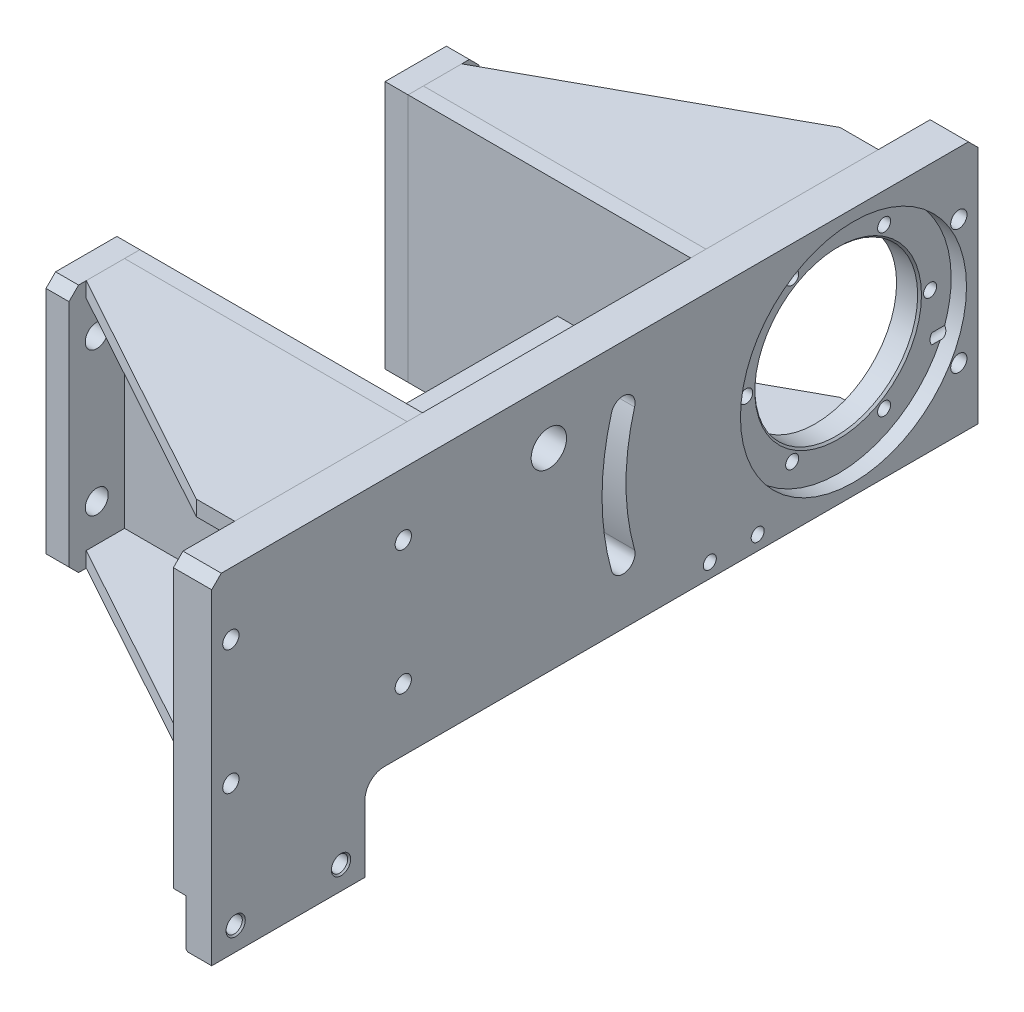
from build123d import *

# Parameters (mm, degrees)
EXTRUDE_1_DEPTH              = 65
EXTRUDE_1_DEPTH_BACK         = 65
SKETCH_2_W                   = 147.5
SKETCH_2_H                   = 8
EXTRUDE_1_2_DEPTH            = 65
EXTRUDE_1_2_DEPTH_BACK       = 65
SKETCH_7_R                   = 2.5
EXTRUDE_6_DEPTH              = 20
SKETCH_8_W                   = 37
SKETCH_8_H                   = 130
EXTRUDE_7_DEPTH              = 12
EXTRUDE_7_2_DEPTH            = 12
CHAMFER_2_SIZE               = 5
CHAMFER_3_SIZE               = 5
SKETCH_12_R                  = 1
CUT_EXTRUDE_4_DEPTH          = 20
SKETCH_16_R                  = 6
CUT_EXTRUDE_8_DEPTH          = 12
SKETCH_11_R                  = 42.5
CUT_EXTRUDE_9_DEPTH          = 20
SKETCH_28_R                  = 59
SKETCH_28_R_2                = 42.5
CUT_EXTRUDE_11_DEPTH         = 8
HOLE_START                   = 147.5
HOLE_WIZARD_M8_4_OUTLINE_R   = 3.4
HOLE_WIZARD_M8_4_DEPTH       = 12
CUT_EXTRUDE_12_DEPTH         = 20
EXTRUDE_12_DEPTH             = 4
EXTRUDE_12_DEPTH_BACK        = 4
SKETCH_33_W                  = 69.5
SKETCH_33_H                  = 140
SKETCH_34_W                  = 15
SKETCH_34_H                  = 32
CUT_EXTRUDE_13_DEPTH         = 285.69676851
EXTRUDE_13_DEPTH             = 8
EXTRUDE_13_2_DEPTH           = 8
EXTRUDE_14_DEPTH             = 8
EXTRUDE_14_2_DEPTH           = 8
CHAMFER_4_SIZE               = 5
SKETCH_40_W                  = 4.25
SKETCH_40_H                  = 179.5
HOLE_WIZARD_M10_1_AT_2_COUNT = 2
HOLE_WIZARD_M10_1_AT_2_PITCH = 65
HOLE_WIZARD_M10_1_AT_3_COUNT = 2
HOLE_WIZARD_M10_1_AT_3_PITCH = 385.519130524
HOLE_WIZARD_M10_1_AT_4_COUNT = 2
HOLE_WIZARD_M10_1_AT_4_PITCH = 380
HOLE_WIZARD_M10_1_AT_5_COUNT = 2
HOLE_WIZARD_M10_1_AT_5_PITCH = 90
HOLE_WIZARD_M10_1_AT_6_COUNT = 2
HOLE_WIZARD_M10_1_AT_6_PITCH = 111.018016556
SKETCH_45_R                  = 6
CUT_EXTRUDE_14_DEPTH         = 291.379493078
HOLE_WIZARD_M8_5_OUTLINE_R   = 3.4
HOLE_WIZARD_M8_5_DEPTH       = 20
HOLE_WIZARD_M8_6_AT_2_COUNT  = 2
HOLE_WIZARD_M8_6_AT_2_PITCH  = 30
CHAMFER_5_SIZE               = 1
HOLE_WIZARD_M10_2_AT_2_COUNT = 2
HOLE_WIZARD_M10_2_AT_2_PITCH = 55
SKETCH_56_W                  = 80
SKETCH_56_H                  = 25
CUT_EXTRUDE_15_DEPTH         = 6.5
CHAMFER_6_SIZE               = 1


# Read off the part's stored shape, not the designer's step: M8 螺纹孔4, M8 螺纹孔5
with BuildPart() as part:
    # 草图2 → 凸台-拉伸1 (new, two sides: drawn at the far end of the back side and taken through both)
    with BuildSketch(Plane(origin=(0, 0, 0), x_dir=(1, 0, 0), z_dir=(0, 1, 0)).offset(-EXTRUDE_1_DEPTH_BACK)):
        with Locations((73.75, -74)):
            Rectangle(SKETCH_2_W, SKETCH_2_H)
    extrude(amount=EXTRUDE_1_DEPTH + EXTRUDE_1_DEPTH_BACK)


with BuildPart() as body_2:
    # 草图2 → Extrude 1 2 (new, two sides: drawn at the far end of the back side and taken through both)
    with BuildSketch(Plane(origin=(0, 0, 0), x_dir=(1, 0, 0), z_dir=(0, 1, 0)).offset(-EXTRUDE_1_2_DEPTH_BACK)):
        with Locations((73.75, 74)):
            Rectangle(SKETCH_2_W, SKETCH_2_H)
    extrude(amount=EXTRUDE_1_2_DEPTH + EXTRUDE_1_2_DEPTH_BACK)


with BuildPart() as body_3:
    # 草图7 → 凸台-拉伸6 (new body)
    with BuildSketch(Plane(origin=(147.5, 0, 0), x_dir=(0, 0, -1), z_dir=(1, 0, 0))):
        with BuildLine():
            Line((-110, -65), (200, -65))
            Line((200, -65), (200, 65))
            Line((200, 65), (-200, 65))
            Line((-200, 65), (-200, -65))
            Line((-200, -65), (-200, -110))
            Line((-200, -110), (-120, -110))
            Line((-120, -110), (-120, -75))
            ThreePointArc((-120, -75), (-117.071067812, -67.928932188), (-110, -65))
        make_face()
        with Locations((-187.5, -98)):
            Circle(SKETCH_7_R, mode=Mode.SUBTRACT)
        with Locations((-132.5, -98)):
            Circle(SKETCH_7_R, mode=Mode.SUBTRACT)
    extrude(amount=EXTRUDE_6_DEPTH)

    # 草图12 → 切除-拉伸4 (cut)
    with BuildSketch(Plane(origin=(167.5, 0, 0), x_dir=(0, 0, -1), z_dir=(1, 0, 0))):
        with Locations((-190, 32.5)):
            Circle(SKETCH_12_R)
        with Locations((-190, -32.5)):
            Circle(SKETCH_12_R)
        with Locations((-100, 32.5)):
            Circle(SKETCH_12_R)
        with Locations((-100, -32.5)):
            Circle(SKETCH_12_R)
    extrude(amount=-CUT_EXTRUDE_4_DEPTH, mode=Mode.SUBTRACT)

    # 草图11 → 切除-拉伸9 (cut)
    with BuildSketch(Plane(origin=(167.5, 0, 0), x_dir=(0, 0, -1), z_dir=(1, 0, 0))):
        with Locations((135, 0)):
            Circle(SKETCH_11_R)
    extrude(amount=-CUT_EXTRUDE_9_DEPTH, mode=Mode.SUBTRACT)

    # 草图28 → 切除-拉伸11 (cut)
    with BuildSketch(Plane(origin=(167.5, 0, 0), x_dir=(0, 0, -1), z_dir=(1, 0, 0))):
        with Locations((135, 0)):
            Circle(SKETCH_28_R)
        with Locations((135, 0)):
            Circle(SKETCH_28_R_2, mode=Mode.SUBTRACT)
    extrude(amount=-CUT_EXTRUDE_11_DEPTH, mode=Mode.SUBTRACT)

    # M8 螺纹孔4 outline → M8 螺纹孔4 (cut)
    with BuildSketch(Plane.YZ.offset(HOLE_START)):
        with Locations((-41.569219382, -159)):
            Circle(HOLE_WIZARD_M8_4_OUTLINE_R)
        with Locations((-41.569219382, -111)):
            Circle(HOLE_WIZARD_M8_4_OUTLINE_R)
        with Locations((0, -87)):
            Circle(HOLE_WIZARD_M8_4_OUTLINE_R)
        with Locations((41.569219382, -111)):
            Circle(HOLE_WIZARD_M8_4_OUTLINE_R)
        with Locations((41.569219382, -159)):
            Circle(HOLE_WIZARD_M8_4_OUTLINE_R)
        with Locations((0, -183)):
            Circle(HOLE_WIZARD_M8_4_OUTLINE_R)
    extrude(amount=HOLE_WIZARD_M8_4_DEPTH, mode=Mode.SUBTRACT)

    # 草图26 → 切除-拉伸12 (cut)
    with BuildSketch(Plane(origin=(167.5, 0, 0), x_dir=(0, 0, -1), z_dir=(1, 0, 0))):
        with BuildLine():
            ThreePointArc((8.698485757, 35.7), (3.75, 0), (8.698485757, -35.7))
            ThreePointArc((8.698485757, -35.7), (16.412843578, -40.014357821), (20.727201399, -32.3))
            ThreePointArc((20.727201399, -32.3), (16.25, 0), (20.727201399, 32.3))
            ThreePointArc((20.727201399, 32.3), (16.412843578, 40.014357821), (8.698485757, 35.7))
        make_face()
    extrude(amount=-CUT_EXTRUDE_12_DEPTH, mode=Mode.SUBTRACT)

    # 倒角4
    chamfer_4_edges = [body_3.edges().sort_by_distance(p)[0] for p in [
        (157.5, 65, 200),
        (157.5, 65, -200),
    ]]
    chamfer(chamfer_4_edges, length=CHAMFER_4_SIZE)

    # 草图40 → M10 螺纹孔1 (revolve, cut)
    with BuildSketch(Plane(origin=(167.5, 32.5, 190), x_dir=(0, 0, -1), z_dir=(0, 1, 0))):
        with Locations((2.125, 89.75)):
            Rectangle(SKETCH_40_W, SKETCH_40_H)
    hole_wizard_m10_1 = revolve(axis=Axis((173.85, 32.5, 190), (-1, 0, 0)), mode=Mode.SUBTRACT)

    # M10 螺纹孔1 at 2: M10 螺纹孔1 ×2
    with Locations(*[(0, -i * HOLE_WIZARD_M10_1_AT_2_PITCH, 0) for i in range(1, HOLE_WIZARD_M10_1_AT_2_COUNT)]):
        add(hole_wizard_m10_1, mode=Mode.SUBTRACT)

    # M10 螺纹孔1 at 3: M10 螺纹孔1 ×2
    with Locations(*[Vector(0, -0.16860382495583923, -0.9856838997418294) * (i * HOLE_WIZARD_M10_1_AT_3_PITCH) for i in range(1, HOLE_WIZARD_M10_1_AT_3_COUNT)]):
        add(hole_wizard_m10_1, mode=Mode.SUBTRACT)

    # M10 螺纹孔1 at 4: M10 螺纹孔1 ×2
    with Locations(*[(0, 0, -i * HOLE_WIZARD_M10_1_AT_4_PITCH) for i in range(1, HOLE_WIZARD_M10_1_AT_4_COUNT)]):
        add(hole_wizard_m10_1, mode=Mode.SUBTRACT)

    # M10 螺纹孔1 at 5: M10 螺纹孔1 ×2
    with Locations(*[(0, 0, -i * HOLE_WIZARD_M10_1_AT_5_PITCH) for i in range(1, HOLE_WIZARD_M10_1_AT_5_COUNT)]):
        add(hole_wizard_m10_1, mode=Mode.SUBTRACT)

    # M10 螺纹孔1 at 6: M10 螺纹孔1 ×2
    with Locations(*[Vector(0, -0.5854905538443586, -0.810679228399881) * (i * HOLE_WIZARD_M10_1_AT_6_PITCH) for i in range(1, HOLE_WIZARD_M10_1_AT_6_COUNT)]):
        add(hole_wizard_m10_1, mode=Mode.SUBTRACT)

    # 草图45 → 切除-拉伸14 (cut, through all)
    with BuildSketch(Plane(origin=(167.5, 0, 0), x_dir=(0, 0, -1), z_dir=(1, 0, 0))):
        with Locations((-24, 36.038535167)):
            Circle(SKETCH_45_R)
    extrude(amount=-CUT_EXTRUDE_14_DEPTH, mode=Mode.SUBTRACT)

    # M8 螺纹孔5 outline → M8 螺纹孔5 (cut)
    with BuildSketch(Plane.YZ.offset(HOLE_START)):
        with Locations((-57.5, -85)):
            Circle(HOLE_WIZARD_M8_5_OUTLINE_R)
        with Locations((-57.5, -60)):
            Circle(HOLE_WIZARD_M8_5_OUTLINE_R)
    extrude(amount=HOLE_WIZARD_M8_5_DEPTH, mode=Mode.SUBTRACT)

    # 草图51 → M20x1.5 螺纹孔1 (revolve, cut)
    with BuildSketch(Plane(origin=(167.5, 36.038535167, 24), x_dir=(0, 0, -1), z_dir=(0, 1, 0))):
        Polygon((0, 0), (0, 53.057960726), (9.25, 47.5), (9.25, 0), align=None)
    revolve(axis=Axis((173.85, 36.038535167, 24), (-1, 0, 0)), mode=Mode.SUBTRACT)

    # 草图49 → M8 螺纹孔6 (revolve, cut)
    with BuildSketch(Plane(origin=(157.5, -22.5, -200), x_dir=(0, 1, 0), z_dir=(1, 0, 0))):
        Polygon((0, 0), (0, 18.292926105), (3.4, 16.25), (3.4, 0), align=None)
    hole_wizard_m8_6 = revolve(axis=Axis((157.5, -22.5, -206.35), (0, 0, 1)), mode=Mode.SUBTRACT)

    # M8 螺纹孔6 at 2: M8 螺纹孔6 ×2
    with Locations(*[(0, -i * HOLE_WIZARD_M8_6_AT_2_PITCH, 0) for i in range(1, HOLE_WIZARD_M8_6_AT_2_COUNT)]):
        add(hole_wizard_m8_6, mode=Mode.SUBTRACT)

    # 倒角5
    chamfer_5_edges = [body_3.edges().sort_by_distance(p)[0] for p in [
        (159.5, 0, -92.5),
    ]]
    chamfer(chamfer_5_edges, length=CHAMFER_5_SIZE)

    # 草图54 → M10 螺纹孔2 (revolve, cut)
    with BuildSketch(Plane(origin=(167.5, -98, 187.5), x_dir=(0, 0, -1), z_dir=(0, 1, 0))):
        Polygon((0, 0), (0, 179.5), (4.25, 179.5), (4.25, 0.775), (5.025, 0), align=None)
    hole_wizard_m10_2 = revolve(axis=Axis((173.85, -98, 187.5), (-1, 0, 0)), mode=Mode.SUBTRACT)

    # M10 螺纹孔2 at 2: M10 螺纹孔2 ×2
    with Locations(*[(0, 0, -i * HOLE_WIZARD_M10_2_AT_2_PITCH) for i in range(1, HOLE_WIZARD_M10_2_AT_2_COUNT)]):
        add(hole_wizard_m10_2, mode=Mode.SUBTRACT)

    # 草图56 → 切除-拉伸15 (cut)
    with BuildSketch(Plane.ZY.offset(-147.5)):
        with Locations((160, -97.5)):
            Rectangle(SKETCH_56_W, SKETCH_56_H)
    extrude(amount=-CUT_EXTRUDE_15_DEPTH, mode=Mode.SUBTRACT)

    # 倒角6
    chamfer_6_edges = [body_3.edges().sort_by_distance(p)[0] for p in [
        (154, -110, 160),
    ]]
    chamfer(chamfer_6_edges, length=CHAMFER_6_SIZE)


with BuildPart() as body_4:
    # 草图8 → 凸台-拉伸7 (new body)
    with BuildSketch(Plane.ZY):
        with Locations((88.5, 0)):
            Rectangle(SKETCH_8_W, SKETCH_8_H)
    extrude(amount=EXTRUDE_7_DEPTH)

    # 倒角2
    chamfer_2_edges = [body_4.edges().sort_by_distance(p)[0] for p in [
        (-6, 65, 107),
        (-6, -65, 107),
    ]]
    chamfer(chamfer_2_edges, length=CHAMFER_2_SIZE)


with BuildPart() as body_5:
    # 草图8 → Extrude 7 2 (new body)
    with BuildSketch(Plane.ZY):
        with Locations((-88.5, 0)):
            Rectangle(SKETCH_8_W, SKETCH_8_H)
    extrude(amount=EXTRUDE_7_2_DEPTH)

    # 倒角3
    chamfer_3_edges = [body_5.edges().sort_by_distance(p)[0] for p in [
        (-6, -65, -107),
        (-6, 65, -107),
    ]]
    chamfer(chamfer_3_edges, length=CHAMFER_3_SIZE)


with BuildPart() as cut_extrude_8_tool:
    # 草图16 → 切除-拉伸8 (new body)
    with BuildSketch(Plane.ZY.offset(12)):
        with Locations((-92.5, 37.5)):
            Circle(SKETCH_16_R)
        with Locations((92.5, 37.5)):
            Circle(SKETCH_16_R)
        with Locations((92.5, -37.5)):
            Circle(SKETCH_16_R)
        with Locations((-92.5, -37.5)):
            Circle(SKETCH_16_R)
    extrude(amount=-CUT_EXTRUDE_8_DEPTH)


with BuildPart() as body_4_1:
    add(body_4.part)

    # 切除-拉伸8: cut by cut_extrude_8_tool
    add(cut_extrude_8_tool.part, mode=Mode.SUBTRACT)


with BuildPart() as body_5_1:
    add(body_5.part)

    # 切除-拉伸8: cut by cut_extrude_8_tool
    add(cut_extrude_8_tool.part, mode=Mode.SUBTRACT)


with BuildPart() as body_6:
    # 草图33 → 凸台-拉伸12 (new, two sides: drawn at the far end of the back side and taken through both)
    with BuildSketch(Plane(origin=(0, 0, 0), x_dir=(1, 0, 0), z_dir=(0, 1, 0)).offset(-EXTRUDE_12_DEPTH_BACK)):
        with Locations((112.75, 0)):
            Rectangle(SKETCH_33_W, SKETCH_33_H)
    extrude(amount=EXTRUDE_12_DEPTH + EXTRUDE_12_DEPTH_BACK)

    # 草图34 → 切除-拉伸13 (cut, through all)
    with BuildSketch(Plane(origin=(0, 4, 0), x_dir=(1, 0, 0), z_dir=(0, 1, 0))):
        with Locations((140, 10.5)):
            Rectangle(SKETCH_34_W, SKETCH_34_H)
    extrude(amount=-CUT_EXTRUDE_13_DEPTH, mode=Mode.SUBTRACT)


with BuildPart() as body_7:
    # 草图36 → 凸台-拉伸13 (new body)
    with BuildSketch(Plane(origin=(0, 65, 0), x_dir=(1, 0, 0), z_dir=(0, 1, 0))):
        Polygon((0, 78), (147.5, 78), (147.5, 168), (127.5, 168), (0, 98), align=None)
    extrude(amount=-EXTRUDE_13_DEPTH)


with BuildPart() as body_8:
    # 草图36 → Extrude 13 2 (new body)
    with BuildSketch(Plane(origin=(0, 65, 0), x_dir=(1, 0, 0), z_dir=(0, 1, 0))):
        Polygon((0, -98), (0, -78), (147.5, -78), (147.5, -168), (127.5, -168), align=None)
    extrude(amount=-EXTRUDE_13_2_DEPTH)


with BuildPart() as body_9:
    # 草图37 → 凸台-拉伸14 (new body)
    with BuildSketch(Plane.XZ.offset(65)):
        Polygon((127.5, 168), (0, 98), (0, 78), (147.5, 78), (147.5, 168), align=None)
    extrude(amount=-EXTRUDE_14_DEPTH)


with BuildPart() as body_10:
    # 草图37 → Extrude 14 2 (new body)
    with BuildSketch(Plane.XZ.offset(65)):
        Polygon((0, -78), (0, -98), (127.5, -168), (147.5, -168), (147.5, -78), align=None)
    extrude(amount=-EXTRUDE_14_2_DEPTH)


solid = Compound([part.part, body_2.part, body_3.part, body_4_1.part, body_5_1.part, body_6.part, body_7.part, body_8.part, body_9.part, body_10.part])
